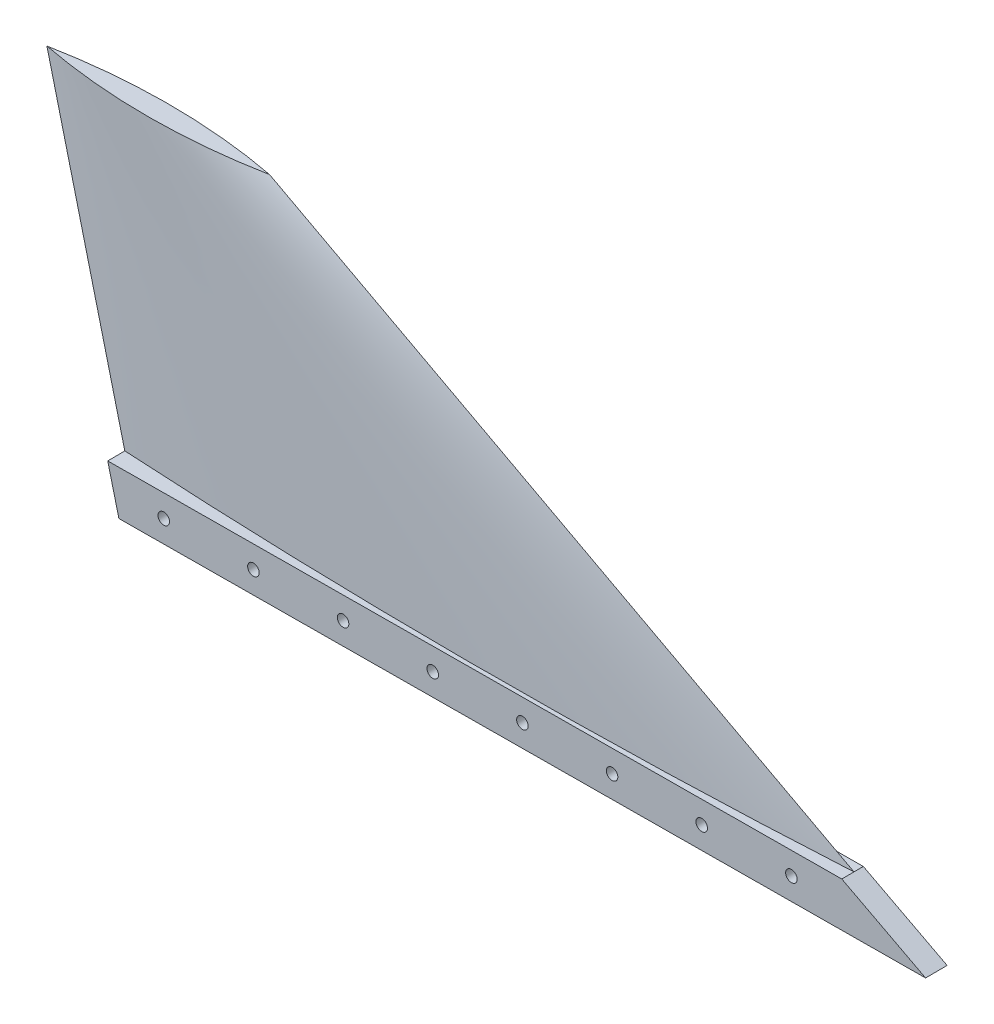
from build123d import *

# Parameters (mm, degrees)
BOSS_EXTRUDE1_DEPTH     = 12.3444
CUT_EXTRUDE1_DEPTH      = 501.459744256
CUT_EXTRUDE1_DEPTH_BACK = 501.459744256
SKETCH12_W              = 6.35
SKETCH12_H              = 25.4
F_1_4_CLEARANCE_HOLE1_D = 6.5278
LPATTERN1_COUNT         = 8
LPATTERN1_PITCH         = 50.8
SKETCH14_W              = 457.208458034
SKETCH14_H              = 25.4
CUT_EXTRUDE2_DEPTH      = 501.552688803


with BuildPart() as part:
    # Sketch5 for Loft4 → Loft4 section 0
    with BuildSketch(Plane(origin=(0, 203.2, 0), x_dir=(1, 0, 0), z_dir=(0, 1, 0))):
        with BuildLine():
            # circular arc as an exact rational Bezier (weights 1, cos(half-angle), 1)
            Bezier((-50.8, 0), (12.7, 12.200977951), (76.2, 0), weights=[1, 0.982036722, 1])
            Bezier((76.2, 0), (12.7, -12.200977951), (-50.8, 0), weights=[1, 0.982036722, 1])
        make_face()
    # Sketch1 for Loft4 → Loft4 section 1
    with BuildSketch(Plane(origin=(0, 0, 0), x_dir=(1, 0, 0), z_dir=(0, 1, 0))):
        with BuildLine():
            Bezier((0, 0), (228.6, 12.098860838), (457.2, 0), weights=[1, 0.99860236, 1])
            Bezier((457.2, 0), (228.6, -12.098860838), (0, 0), weights=[1, 0.99860236, 1])
        make_face()
    loft()

    # Sketch10 → Boss-Extrude1 (add)
    with BuildSketch(Plane(origin=(-0.017486684, 0, -2.568968528), x_dir=(0, -1, 0), z_dir=(0.006806731520561807, 0, 0.9999768339346702))):
        Polygon((0, 457.189408475), (0, 0), (-25.4, -6.349852895), (-25.4, 409.565511759), align=None)
    extrude(amount=BOSS_EXTRUDE1_DEPTH)

    # Sketch12 → Cut-Extrude1 (cut, two sides: drawn at the far end of the back side and taken through both)
    with BuildSketch(Plane(origin=(0, 0, 0), x_dir=(0.006806731520561809, 0, 0.9999768339346703), z_dir=(-0.9999768339346703, 0, 0.006806731520561809)).offset(-CUT_EXTRUDE1_DEPTH_BACK)):
        with Locations((12.950371958, 12.7)):
            Rectangle(SKETCH12_W, SKETCH12_H)
        with Locations((-5.744028042, 12.7)):
            Rectangle(SKETCH12_W, SKETCH12_H)
    extrude(amount=CUT_EXTRUDE1_DEPTH + CUT_EXTRUDE1_DEPTH_BACK, mode=Mode.SUBTRACT)

    # 1/4 Clearance Hole1 (through all)
    with Locations(Plane(origin=(0.097036893, 0, 14.25568857), x_dir=(0, -1, 0), z_dir=(0.006806731520561807, 0, 0.9999768339346702))):
        with Locations((-12.7, 25.4)):
            f_1_4_clearance_hole1 = Hole(F_1_4_CLEARANCE_HOLE1_D / 2)

    # LPattern1: 1/4 Clearance Hole1 ×8
    with Locations(*[(i * LPATTERN1_PITCH, 0, 0) for i in range(1, LPATTERN1_COUNT)]):
        add(f_1_4_clearance_hole1, mode=Mode.SUBTRACT)

    # Sketch14 → Cut-Extrude2 (cut, through all)
    with BuildSketch(Plane(origin=(0.066538332, 0, 9.775145501), x_dir=(0.9999768339346702, 0, -0.006806731520561792), z_dir=(0.006806731520561792, 0, 0.9999768339346703))):
        with Locations((228.585179458, -12.6238)):
            Rectangle(SKETCH14_W, SKETCH14_H)
    extrude(amount=-CUT_EXTRUDE2_DEPTH, mode=Mode.SUBTRACT)


solid = part.part
